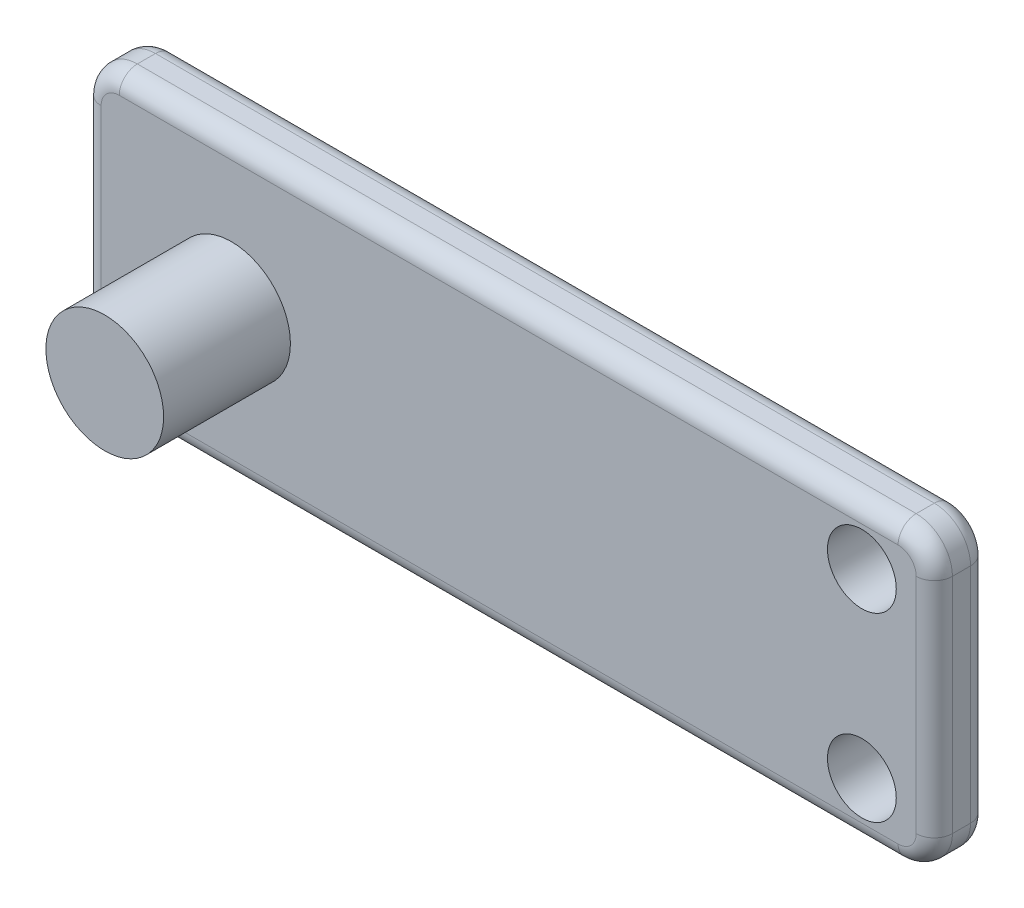
from build123d import *

# Parameters (mm, degrees)
SKETCH1_W           = 47
SKETCH1_H           = 16.3
SKETCH1_R           = 1.9
BOSS_EXTRUDE1_DEPTH = 3
SKETCH2_R           = 3.25
BOSS_EXTRUDE2_DEPTH = 10
FILLET1_R           = 1
FILLET2_R           = 2


with BuildPart() as part:
    # Sketch1 → Boss-Extrude1 (new body)
    with BuildSketch(Plane.XY):
        Rectangle(SKETCH1_W, SKETCH1_H)
        with Locations((19.5, 5)):
            Circle(SKETCH1_R, mode=Mode.SUBTRACT)
        with Locations((19.5, -5)):
            Circle(SKETCH1_R, mode=Mode.SUBTRACT)
    extrude(amount=BOSS_EXTRUDE1_DEPTH)

    # Sketch2 → Boss-Extrude2 (add)
    with BuildSketch(Plane.XY):
        with Locations((-15.3, 0)):
            Circle(SKETCH2_R)
    extrude(amount=BOSS_EXTRUDE2_DEPTH)

    # Fillet1
    fillet1_edges = [part.edges().sort_by_distance(p)[0] for p in [
        (-23.5, 0, 3),
        (0, -8.15, 3),
        (23.5, 0, 3),
        (0, -8.15, 0),
        (-23.5, 0, 0),
        (0, 8.15, 0),
        (23.5, 0, 0),
        (0, 8.15, 3),
    ]]
    fillet(fillet1_edges, radius=FILLET1_R)

    # Fillet2
    # the kernel refuses this fillet: 2 mm, written as the material it takes off along each edge
    with BuildSketch(Plane(origin=(-21.5, -6.15, 0), x_dir=(0, -1, 0), z_dir=(1, 0, 0))) as fillet2_piece_1:
        with BuildLine():
            CenterArc((1, -1), 1, 0, 90)
            Line((2, -1), (2, 0))
            Line((2, 0), (1, 0))
        make_face()
    revolve(axis=Axis((-21.5, -6.15, 0), (0, 0, -1)), revolution_arc=90, mode=Mode.SUBTRACT)
    with BuildSketch(Plane(origin=(-21.5, 6.15, 0), x_dir=(-1, 0, 0), z_dir=(0, -1, 0))) as fillet2_piece_2:
        with BuildLine():
            CenterArc((1, -1), 1, 0, 90)
            Line((2, -1), (2, 0))
            Line((2, 0), (1, 0))
        make_face()
    revolve(axis=Axis((-21.5, 6.15, 0), (0, 0, -1)), revolution_arc=90, mode=Mode.SUBTRACT)
    with BuildSketch(Plane(origin=(21.5, -6.15, 0), x_dir=(1, 0, 0), z_dir=(0, 1, 0))) as fillet2_piece_3:
        with BuildLine():
            CenterArc((1, -1), 1, 0, 90)
            Line((2, -1), (2, 0))
            Line((2, 0), (1, 0))
        make_face()
    revolve(axis=Axis((21.5, -6.15, 0), (0, 0, -1)), revolution_arc=90, mode=Mode.SUBTRACT)
    with BuildSketch(Plane(origin=(21.5, 6.15, 0), x_dir=(0, 1, 0), z_dir=(-1, 0, 0))) as fillet2_piece_4:
        with BuildLine():
            CenterArc((1, -1), 1, 0, 90)
            Line((2, -1), (2, 0))
            Line((2, 0), (1, 0))
        make_face()
    revolve(axis=Axis((21.5, 6.15, 0), (0, 0, -1)), revolution_arc=90, mode=Mode.SUBTRACT)
    with BuildSketch(Plane(origin=(21.5, -6.15, 3), x_dir=(0, -1, 0), z_dir=(-1, 0, 0))) as fillet2_piece_5:
        with BuildLine():
            CenterArc((1, -1), 1, 0, 90)
            Line((2, -1), (2, 0))
            Line((2, 0), (1, 0))
        make_face()
    revolve(axis=Axis((21.5, -6.15, 3), (0, 0, 1)), revolution_arc=90, mode=Mode.SUBTRACT)
    with BuildSketch(Plane(origin=(-21.5, -6.15, 3), x_dir=(-1, 0, 0), z_dir=(0, 1, 0))) as fillet2_piece_6:
        with BuildLine():
            CenterArc((1, -1), 1, 0, 90)
            Line((2, -1), (2, 0))
            Line((2, 0), (1, 0))
        make_face()
    revolve(axis=Axis((-21.5, -6.15, 3), (0, 0, 1)), revolution_arc=90, mode=Mode.SUBTRACT)
    with BuildSketch(Plane(origin=(21.5, 6.15, 3), x_dir=(1, 0, 0), z_dir=(0, -1, 0))) as fillet2_piece_7:
        with BuildLine():
            CenterArc((1, -1), 1, 0, 90)
            Line((2, -1), (2, 0))
            Line((2, 0), (1, 0))
        make_face()
    revolve(axis=Axis((21.5, 6.15, 3), (0, 0, 1)), revolution_arc=90, mode=Mode.SUBTRACT)
    with BuildSketch(Plane(origin=(-21.5, 6.15, 3), x_dir=(0, 1, 0), z_dir=(1, 0, 0))) as fillet2_piece_8:
        with BuildLine():
            CenterArc((1, -1), 1, 0, 90)
            Line((2, -1), (2, 0))
            Line((2, 0), (1, 0))
        make_face()
    revolve(axis=Axis((-21.5, 6.15, 3), (0, 0, 1)), revolution_arc=90, mode=Mode.SUBTRACT)
    with BuildSketch(Plane(origin=(23.5, 8.15, 0), x_dir=(-1, 0, 0), z_dir=(0, 0, 1)), Plane(origin=(23.5, -8.15, 0), x_dir=(0, 1, 0), z_dir=(0, 0, 1))) as fillet2_piece_9:
        with BuildLine():
            CenterArc((FILLET2_R, FILLET2_R), FILLET2_R, 180, 90)
            Line((0, FILLET2_R), (0, 0))
            Line((0, 0), (FILLET2_R, 0))
        make_face()
    extrude(amount=3, mode=Mode.SUBTRACT)
    with BuildSketch(Plane(origin=(-23.5, -8.15, 0), x_dir=(0, 1, 0), z_dir=(0, 0, 1)), Plane(origin=(-23.5, 8.15, 0), x_dir=(1, 0, 0), z_dir=(0, 0, 1))) as fillet2_piece_10:
        with BuildLine():
            CenterArc((FILLET2_R, -FILLET2_R), FILLET2_R, 90, 90)
            Line((0, -FILLET2_R), (0, 0))
            Line((0, 0), (FILLET2_R, 0))
        make_face()
    extrude(amount=3, mode=Mode.SUBTRACT)


solid = part.part
